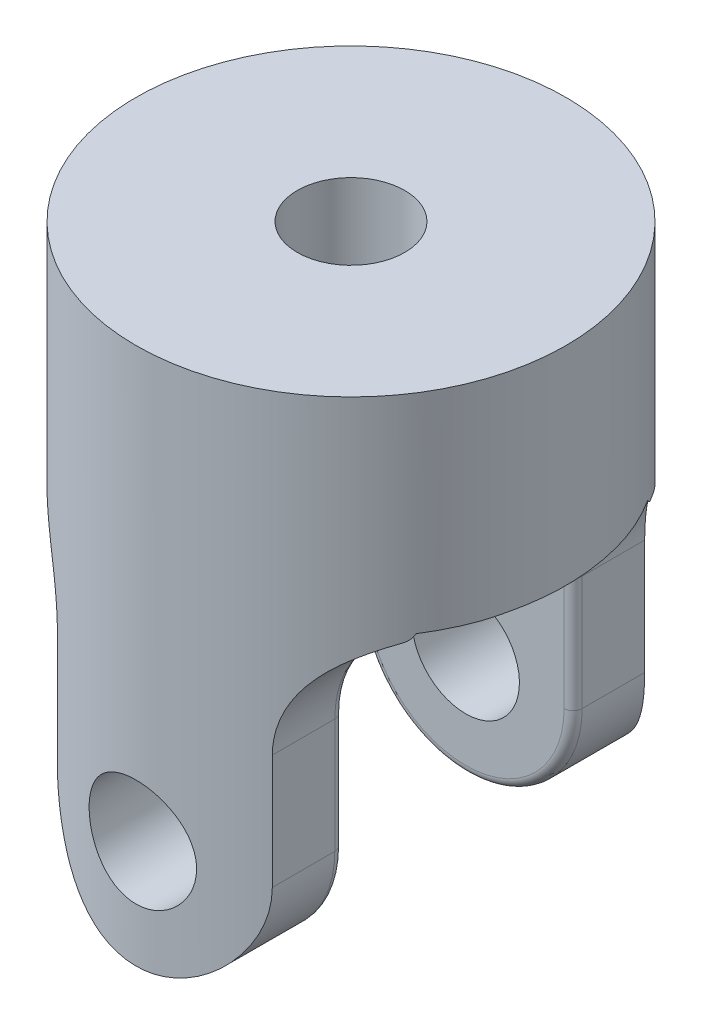
from build123d import *

# Parameters (mm, degrees)
SKETCH1_R               = 19.05
BASE_EXTRUDE_DEPTH      = 47.625
CUT_EXTRUDE1_DEPTH      = 55.716959208
CUT_EXTRUDE1_DEPTH_BACK = 55.716959208
CUT_EXTRUDE5_DEPTH      = 47.625
CUT_EXTRUDE5_DEPTH_BACK = 55.716959365
SKETCH8_W               = 20.32
SKETCH8_H               = 36.600526062
FILLET1_R               = 0.8001
CUT_EXTRUDE6_DEPTH      = 55.716959365
CUT_EXTRUDE6_DEPTH_BACK = 55.716959365
SKETCH11_R              = 4.7625
SKETCH12_R              = 4.7625
CUT_EXTRUDE7_DEPTH      = 55.716959365


with BuildPart() as part:
    # Sketch1 → Base-Extrude (new body)
    with BuildSketch(Plane(origin=(0, 0, 0), x_dir=(-1, 0, 0), z_dir=(0, 1, 0))):
        with Locations(Location((0, 0, 0), (0, 0, 90))):
            Circle(SKETCH1_R)
    extrude(amount=BASE_EXTRUDE_DEPTH)

    # Sketch2 → Cut-Extrude1 (cut, two sides: drawn at the far end of the back side and taken through both)
    with BuildSketch(Plane.XY.offset(-CUT_EXTRUDE1_DEPTH_BACK)):
        with BuildLine():
            Line((9.525, 9.525), (9.525, 19.685))
            ThreePointArc((9.525, 19.685), (12.314807909, 26.420192091), (19.05, 29.21))
            Line((19.05, 29.21), (19.05, -1.366191125))
            Line((19.05, -1.366191125), (-19.05, -1.366191125))
            Line((-19.05, -1.366191125), (-19.05, 29.21))
            ThreePointArc((-19.05, 29.21), (-12.314807909, 26.420192091), (-9.525, 19.685))
            Line((-9.525, 19.685), (-9.525, 9.525))
            ThreePointArc((-9.525, 9.525), (0, 0), (9.525, 9.525))
        make_face()
    extrude(amount=CUT_EXTRUDE1_DEPTH + CUT_EXTRUDE1_DEPTH_BACK, mode=Mode.SUBTRACT)

    # Sketch8 → Cut-Extrude5 (cut, two sides: drawn at the far end of the back side and taken through both)
    with BuildSketch(Plane(origin=(0, 0, 0), x_dir=(0, 0, -1), z_dir=(1, 0, 0)).offset(-CUT_EXTRUDE5_DEPTH_BACK)):
        with Locations((0, 10.844975795)):
            Rectangle(SKETCH8_W, SKETCH8_H)
    extrude(amount=CUT_EXTRUDE5_DEPTH + CUT_EXTRUDE5_DEPTH_BACK, mode=Mode.SUBTRACT)

    # Fillet1
    # the kernel refuses this fillet: 0.8001 mm, written as the material it takes off along each edge
    with BuildSketch(Plane(origin=(0, 9.525, -10.16), x_dir=(1, 0, 0), z_dir=(0, 1, 0))) as fillet1_piece_1:
        with BuildLine():
            CenterArc((9.525 - FILLET1_R, FILLET1_R), FILLET1_R, 270, 90)
            Line((9.525, FILLET1_R), (9.525, 0))
            Line((9.525, 0), (9.525 - FILLET1_R, 0))
        make_face()
    revolve(axis=Axis((0, 9.525, -10.16), (0, 0, -1)), revolution_arc=180, mode=Mode.SUBTRACT)
    with BuildSketch(Plane(origin=(0, 9.525, 10.16), x_dir=(1, 0, 0), z_dir=(0, 1, 0))) as fillet1_piece_2:
        with BuildLine():
            CenterArc((9.525 - FILLET1_R, -FILLET1_R), FILLET1_R, 0, 90)
            Line((9.525 - FILLET1_R, 0), (9.525, 0))
            Line((9.525, 0), (9.525, -FILLET1_R))
        make_face()
    revolve(axis=Axis((0, 9.525, 10.16), (0, 0, -1)), revolution_arc=180, mode=Mode.SUBTRACT)
    with BuildSketch(Plane(origin=(9.525, 19.685, 10.16), x_dir=(0, 0, 1), z_dir=(0, -1, 0))) as fillet1_piece_3:
        with BuildLine():
            CenterArc((FILLET1_R, FILLET1_R), FILLET1_R, 180, 90)
            Line((0, FILLET1_R), (0, 0))
            Line((0, 0), (FILLET1_R, 0))
        make_face()
    extrude(amount=10.16, mode=Mode.SUBTRACT)
    with BuildSketch(Plane(origin=(19.05, 19.685, 10.16), x_dir=(-1, 0, 0), z_dir=(0, -1, 0))) as fillet1_piece_4_section:
        with BuildLine():
            CenterArc((9.525 + FILLET1_R, -FILLET1_R), FILLET1_R, 90, 90)
            Line((9.525 + FILLET1_R, 0), (9.525, 0))
            Line((9.525, 0), (9.525, -FILLET1_R))
        make_face()
    fillet1_piece_4 = revolve(axis=Axis((19.05, 19.685, 10.16), (0, 0, -1)), revolution_arc=84.085046105, mode=Mode.PRIVATE)
    fillet1_piece_4 = split(fillet1_piece_4, bisect_by=Plane(origin=(11.180350867, 29.145238826, 10.386376784), z_dir=(0, -1, 0)), keep=Keep.TOP, mode=Mode.PRIVATE)
    add(fillet1_piece_4, mode=Mode.SUBTRACT)
    with BuildSketch(Plane(origin=(19.05, 19.685, -10.16), x_dir=(-1, 0, 0), z_dir=(0, -1, 0))) as fillet1_piece_5_section:
        with BuildLine():
            CenterArc((9.525 + FILLET1_R, FILLET1_R), FILLET1_R, 180, 90)
            Line((9.525, FILLET1_R), (9.525, 0))
            Line((9.525, 0), (9.525 + FILLET1_R, 0))
        make_face()
    fillet1_piece_5 = revolve(axis=Axis((19.05, 19.685, -10.16), (0, 0, -1)), revolution_arc=84.085046117, mode=Mode.PRIVATE)
    fillet1_piece_5 = split(fillet1_piece_5, bisect_by=Plane(origin=(9.358714509, 29.145238826, -10.293177934), z_dir=(0, -1, 0)), keep=Keep.TOP, mode=Mode.PRIVATE)
    add(fillet1_piece_5, mode=Mode.SUBTRACT)
    with BuildSketch(Plane(origin=(9.525, 9.525, -10.16), x_dir=(-1, 0, 0), z_dir=(0, 1, 0)), Plane(origin=(-9.525, 9.525, 10.16), x_dir=(1, 0, 0), z_dir=(0, 1, 0)), Plane(origin=(-9.525, 19.685, -10.16), x_dir=(1, 0, 0), z_dir=(0, -1, 0))) as fillet1_piece_6:
        with BuildLine():
            CenterArc((FILLET1_R, -FILLET1_R), FILLET1_R, 90, 90)
            Line((0, -FILLET1_R), (0, 0))
            Line((0, 0), (FILLET1_R, 0))
        make_face()
    extrude(amount=10.16, mode=Mode.SUBTRACT)
    with BuildSketch(Plane(origin=(-19.05, 19.685, 10.16), x_dir=(0.1030521452465983, 0.9946759549522016, 0), z_dir=(-0.9946759549522016, 0.1030521452465983, 0))) as fillet1_piece_7_section:
        with BuildLine():
            CenterArc((9.525 + FILLET1_R, -FILLET1_R), FILLET1_R, 90, 90)
            Line((9.525, -FILLET1_R), (9.525, 0))
            Line((9.525, 0), (9.525 + FILLET1_R, 0))
        make_face()
    fillet1_piece_7 = revolve(axis=Axis((-19.05, 19.685, 10.16), (0, 0, -1)), revolution_arc=84.085046117, mode=Mode.PRIVATE)
    fillet1_piece_7 = split(fillet1_piece_7, bisect_by=Plane(origin=(-11.180351388, 29.145238826, 10.386376138), z_dir=(0, -1, 0)), keep=Keep.TOP, mode=Mode.PRIVATE)
    add(fillet1_piece_7, mode=Mode.SUBTRACT)
    with BuildSketch(Plane(origin=(-19.05, 19.685, -10.16), x_dir=(0.10305214545411669, 0.9946759549307018, 0), z_dir=(-0.9946759549307018, 0.10305214545411669, 0))) as fillet1_piece_8_section:
        with BuildLine():
            CenterArc((9.525 + FILLET1_R, FILLET1_R), FILLET1_R, 180, 90)
            Line((9.525, FILLET1_R), (9.525, 0))
            Line((9.525, 0), (9.525 + FILLET1_R, 0))
        make_face()
    fillet1_piece_8 = revolve(axis=Axis((-19.05, 19.685, -10.16), (0, 0, -1)), revolution_arc=84.085046105, mode=Mode.PRIVATE)
    fillet1_piece_8 = split(fillet1_piece_8, bisect_by=Plane(origin=(-11.180350867, 29.145238826, -10.386376784), z_dir=(0, -1, 0)), keep=Keep.TOP, mode=Mode.PRIVATE)
    add(fillet1_piece_8, mode=Mode.SUBTRACT)

    # Sketch11 → Cut-Extrude6 (cut, two sides: drawn at the far end of the back side and taken through both)
    with BuildSketch(Plane.XY.offset(-CUT_EXTRUDE6_DEPTH_BACK)):
        with Locations(Location((0, 9.525, 0), (0, 0, 270))):
            Circle(SKETCH11_R)
    extrude(amount=CUT_EXTRUDE6_DEPTH + CUT_EXTRUDE6_DEPTH_BACK, mode=Mode.SUBTRACT)

    # Sketch12 → Cut-Extrude7 (cut, through all)
    with BuildSketch(Plane(origin=(0, 47.625, 0), x_dir=(-1, 0, 0), z_dir=(0, 1, 0))):
        with Locations(Location((0, 0, 0), (0, 0, 90))):
            Circle(SKETCH12_R)
    extrude(amount=-CUT_EXTRUDE7_DEPTH, mode=Mode.SUBTRACT)


solid = part.part
